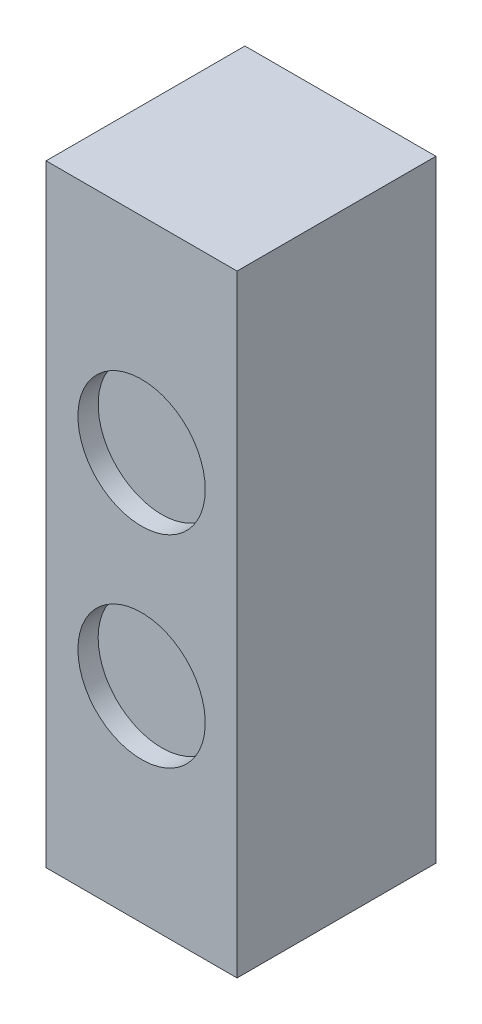
from build123d import *

# Parameters (mm, degrees)
SKETCH2_W           = 24.003
SKETCH2_H           = 76.962
BOSS_EXTRUDE1_DEPTH = 24.9936
SKETCH3_R           = 8.001
CUT_EXTRUDE1_DEPTH  = 2.54


with BuildPart() as part:
    # Sketch2 → Boss-Extrude1 (new body)
    with BuildSketch(Plane.XY):
        with Locations((12.0015, 38.481)):
            Rectangle(SKETCH2_W, SKETCH2_H)
    extrude(amount=BOSS_EXTRUDE1_DEPTH)

    # Sketch3 → Cut-Extrude1 (cut)
    with BuildSketch(Plane.XY.offset(24.9936)):
        with Locations((12.0015, 51.181)):
            Circle(SKETCH3_R)
        with Locations((12.0015, 25.781)):
            Circle(SKETCH3_R)
    extrude(amount=-CUT_EXTRUDE1_DEPTH, mode=Mode.SUBTRACT)


solid = part.part
